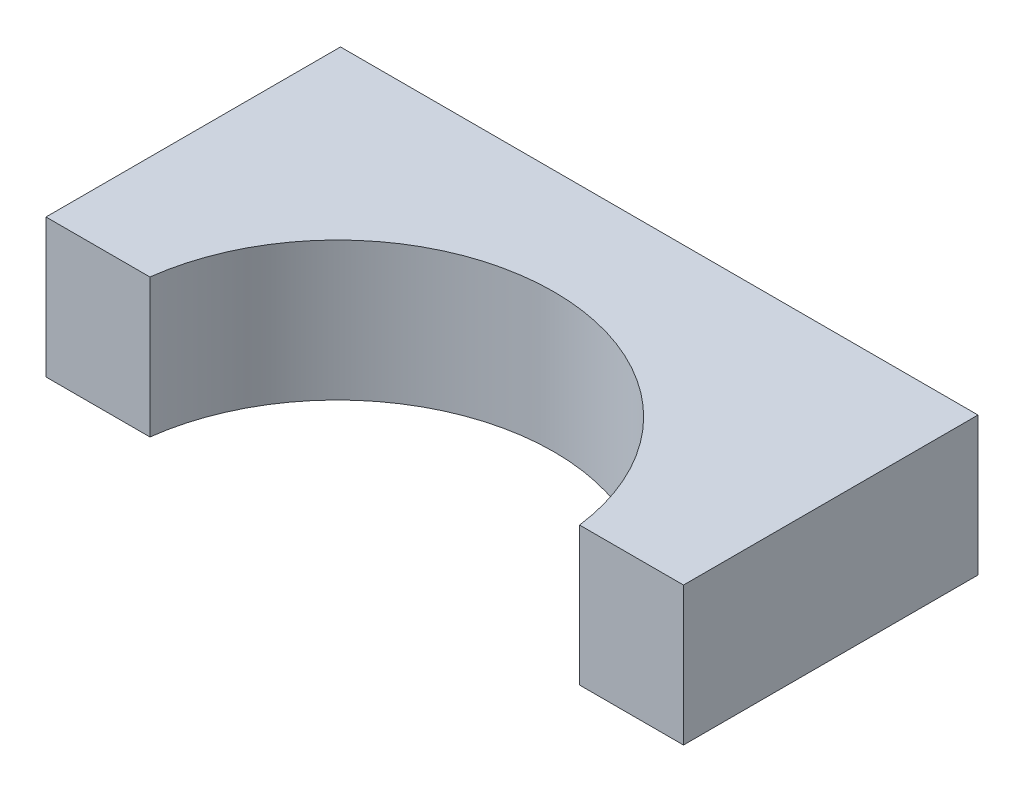
from build123d import *

# Parameters (mm, degrees)
BOSS_EXTRUDE1_DEPTH = 10.16


with BuildPart() as part:
    # Sketch2 → Boss-Extrude1 (new body)
    with BuildSketch(Plane(origin=(0, 0, 0), x_dir=(1, 0, 0), z_dir=(0, 1, 0))):
        with BuildLine():
            Line((-14.986, -8.89), (-7.366, -8.89))
            ThreePointArc((-7.366, -8.89), (8.382, 4.980973803), (24.13, -8.89))
            Line((24.13, -8.89), (31.75, -8.89))
            Line((31.75, -8.89), (31.75, 12.7))
            Line((31.75, 12.7), (-14.986, 12.7))
            Line((-14.986, 12.7), (-14.986, -8.89))
        make_face()
    extrude(amount=-BOSS_EXTRUDE1_DEPTH)


solid = part.part
